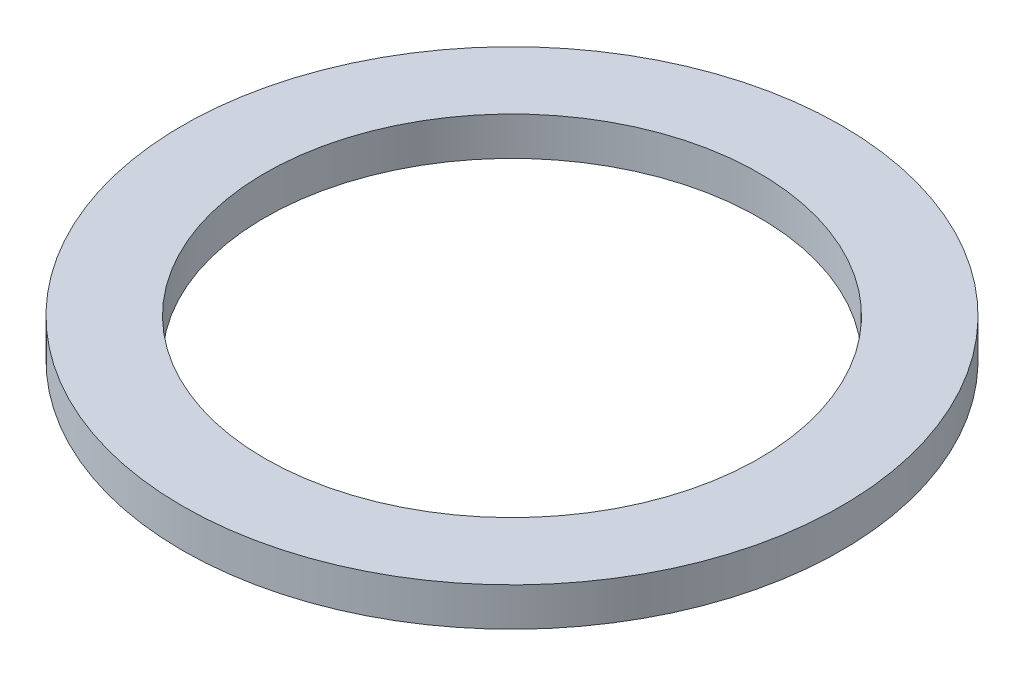
from build123d import *

# Parameters (mm, degrees)
SKETCH1_R           = 60
BOSS_EXTRUDE1_DEPTH = 7
SKETCH2_R           = 45
CUT_EXTRUDE1_DEPTH  = 86.141059425


with BuildPart() as part:
    # Sketch1 → Boss-Extrude1 (new body)
    with BuildSketch(Plane(origin=(0, 0, 0), x_dir=(1, 0, 0), z_dir=(0, 1, 0))):
        Circle(SKETCH1_R)
    extrude(amount=BOSS_EXTRUDE1_DEPTH)

    # Sketch2 → Cut-Extrude1 (cut, through all)
    with BuildSketch(Plane(origin=(0, 0, 0), x_dir=(1, 0, 0), z_dir=(0, 1, 0))):
        Circle(SKETCH2_R)
    extrude(amount=CUT_EXTRUDE1_DEPTH, mode=Mode.SUBTRACT)


solid = part.part
